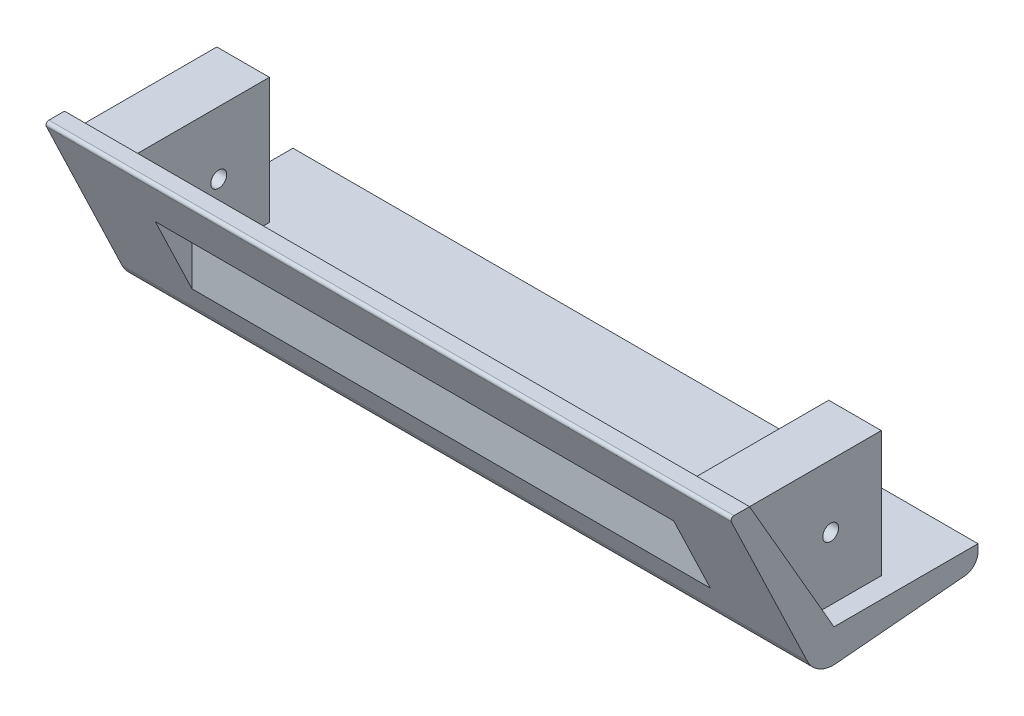
from build123d import *

# Parameters (mm, degrees)
BOSS_EXTRUDE2_DEPTH             = 118.925
BOSS_EXTRUDE1_REACH             = 140.65
SKETCH2_W                       = 18.25
SKETCH2_H                       = 43.65
BOSS_EXTRUDE1_DIRECTION_2_DEPTH = 20
CUT_EXTRUDE2_DEPTH              = 90
FILLET1_R                       = 10
FILLET2_R                       = 5
FILLET3_R                       = 1
M5_CLEARANCE_HOLE1_D            = 5.5


with BuildPart() as part:
    # Sketch1 → Boss-Extrude2 (new, symmetric)
    with BuildSketch(Plane(origin=(0, 0, 0), x_dir=(0, 0, -1), z_dir=(1, 0, 0))):
        Polygon((0, 0), (-29.329393675, 50.8), (-36.329393675, 50.8), (-6.252899132, -12), (50, -7), (50, 0), align=None)
    extrude(amount=BOSS_EXTRUDE2_DEPTH, both=True)

    # Boss-Extrude1: up to this plane
    boss_extrude1_end = Plane(origin=(118.925, 0, 0), z_dir=(0, -0.5000000000000043, 0.8660254037844363))
    # Sketch2 → Boss-Extrude1 (add, up to the surface)
    with BuildSketch(Plane.XY, mode=Mode.PRIVATE) as boss_extrude1_sk1:
        with Locations((106.225, 25.4)):
            Rectangle(SKETCH2_W, SKETCH2_H)
    boss_extrude1_tool1 = split(extrude(boss_extrude1_sk1.sketch, amount=BOSS_EXTRUDE1_REACH, mode=Mode.PRIVATE), bisect_by=boss_extrude1_end, keep=Keep.BOTH, mode=Mode.PRIVATE)
    add(boss_extrude1_tool1.solids().sort_by_distance((106.225, 25.4, 0))[0])
    # Sketch2 → Boss-Extrude1 (add, up to the surface)
    with BuildSketch(Plane.XY, mode=Mode.PRIVATE) as boss_extrude1_sk2:
        with Locations((-106.225, 25.4)):
            Rectangle(SKETCH2_W, SKETCH2_H)
    boss_extrude1_tool2 = split(extrude(boss_extrude1_sk2.sketch, amount=BOSS_EXTRUDE1_REACH, mode=Mode.PRIVATE), bisect_by=boss_extrude1_end, keep=Keep.BOTH, mode=Mode.PRIVATE)
    add(boss_extrude1_tool2.solids().sort_by_distance((-106.225, 25.4, 0))[0])

    # Sketch2 → Boss-Extrude1 direction 2 (add)
    with BuildSketch(Plane.XY):
        with Locations((106.225, 25.4)):
            Rectangle(SKETCH2_W, SKETCH2_H)
        with Locations((-106.225, 25.4)):
            Rectangle(SKETCH2_W, SKETCH2_H)
    extrude(amount=-BOSS_EXTRUDE1_DIRECTION_2_DEPTH)

    # Sketch4 → Cut-Extrude2 (cut, symmetric)
    with BuildSketch(Plane(origin=(0, 0, 0), x_dir=(0, 0, -1), z_dir=(1, 0, 0))):
        Polygon((-26.729651832, 30.755649855), (-20, 34.641016151), (-14, 24.248711306), (-14, 4.176018579), align=None)
    extrude(amount=CUT_EXTRUDE2_DEPTH, both=True, mode=Mode.SUBTRACT)

    # Fillet1
    fillet1_edges = [part.edges().sort_by_distance(p)[0] for p in [
        (0, -12, 6.252899132),
    ]]
    fillet(fillet1_edges, radius=FILLET1_R)

    # Fillet2
    fillet2_edges = [part.edges().sort_by_distance(p)[0] for p in [
        (0, -7, -50),
    ]]
    fillet(fillet2_edges, radius=FILLET2_R)

    # Fillet3
    fillet3_edges = [part.edges().sort_by_distance(p)[0] for p in [
        (0, 50.8, 36.329393675),
    ]]
    fillet(fillet3_edges, radius=FILLET3_R)

    # M5 Clearance Hole1 (through all)
    with Locations(Plane(origin=(115.35, 0, 0), x_dir=(0, 0, -1), z_dir=(1, 0, 0))):
        with Locations((2.420606325, 25.4)):
            Hole(M5_CLEARANCE_HOLE1_D / 2)


solid = part.part
